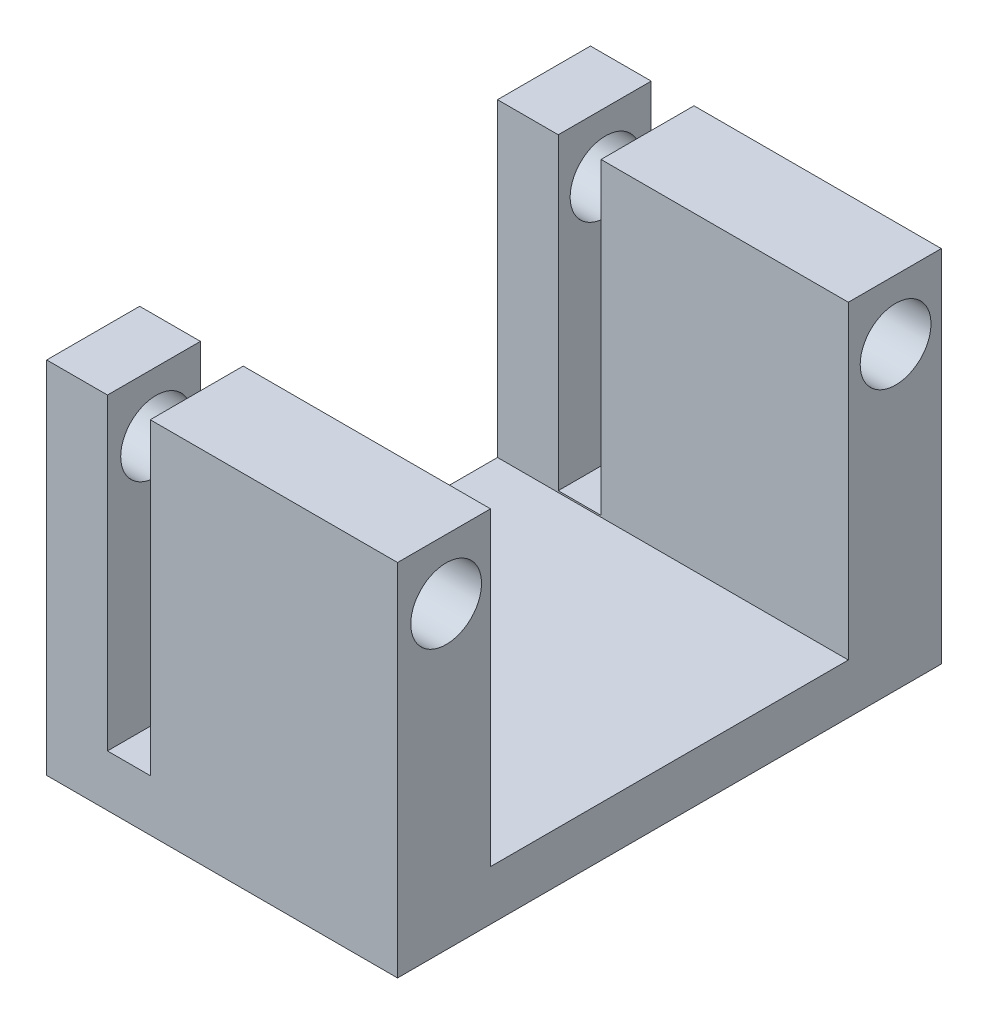
from build123d import *

# Parameters (mm, degrees)
SKETCH1_W               = 22.2885
SKETCH1_H               = 34.544
BOSS_EXTRUDE1_DEPTH     = 3.175
SKETCH1_3_W             = 22.2885
SKETCH1_3_H             = 5.9055
BOSS_EXTRUDE2_DEPTH     = 22.86
CUT_EXTRUDE1_DEPTH      = 17.272
CUT_EXTRUDE1_DEPTH_BACK = 49.784
SKETCH2_W               = 2.7178
SKETCH2_H               = 19.581679607
F_8_CLEARANCE_HOLE1_D   = 4.4958


with BuildPart() as part:
    # Sketch1 → Boss-Extrude1 (new body)
    with BuildSketch(Plane(origin=(0, 0, 0), x_dir=(1, 0, 0), z_dir=(0, 1, 0))):
        Rectangle(SKETCH1_W, SKETCH1_H)
    extrude(amount=BOSS_EXTRUDE1_DEPTH)

    # Sketch1<3> → Boss-Extrude2 (add)
    with BuildSketch(Plane(origin=(0, 0, 0), x_dir=(1, 0, 0), z_dir=(0, 1, 0))):
        with Locations((0, 14.31925)):
            Rectangle(SKETCH1_3_W, SKETCH1_3_H)
        with Locations((0, -14.31925)):
            Rectangle(SKETCH1_3_W, SKETCH1_3_H)
    extrude(amount=BOSS_EXTRUDE2_DEPTH)

    # Sketch2 → Cut-Extrude1 (cut, two sides: drawn at the far end of the back side and taken through both)
    with BuildSketch(Plane(origin=(0, 0, -17.272), x_dir=(-1, 0, 0), z_dir=(0, 0, -1)).offset(-CUT_EXTRUDE1_DEPTH_BACK)):
        with Locations((5.92455, 13.069160197)):
            Rectangle(SKETCH2_W, SKETCH2_H)
    extrude(amount=CUT_EXTRUDE1_DEPTH + CUT_EXTRUDE1_DEPTH_BACK, mode=Mode.SUBTRACT)

    # #8 Clearance Hole1 (through all)
    with Locations(Plane.ZY.offset(11.14425)):
        with Locations((-14.367948463, 19.05), (14.184332508, 19.05)):
            Hole(F_8_CLEARANCE_HOLE1_D / 2)


solid = part.part
